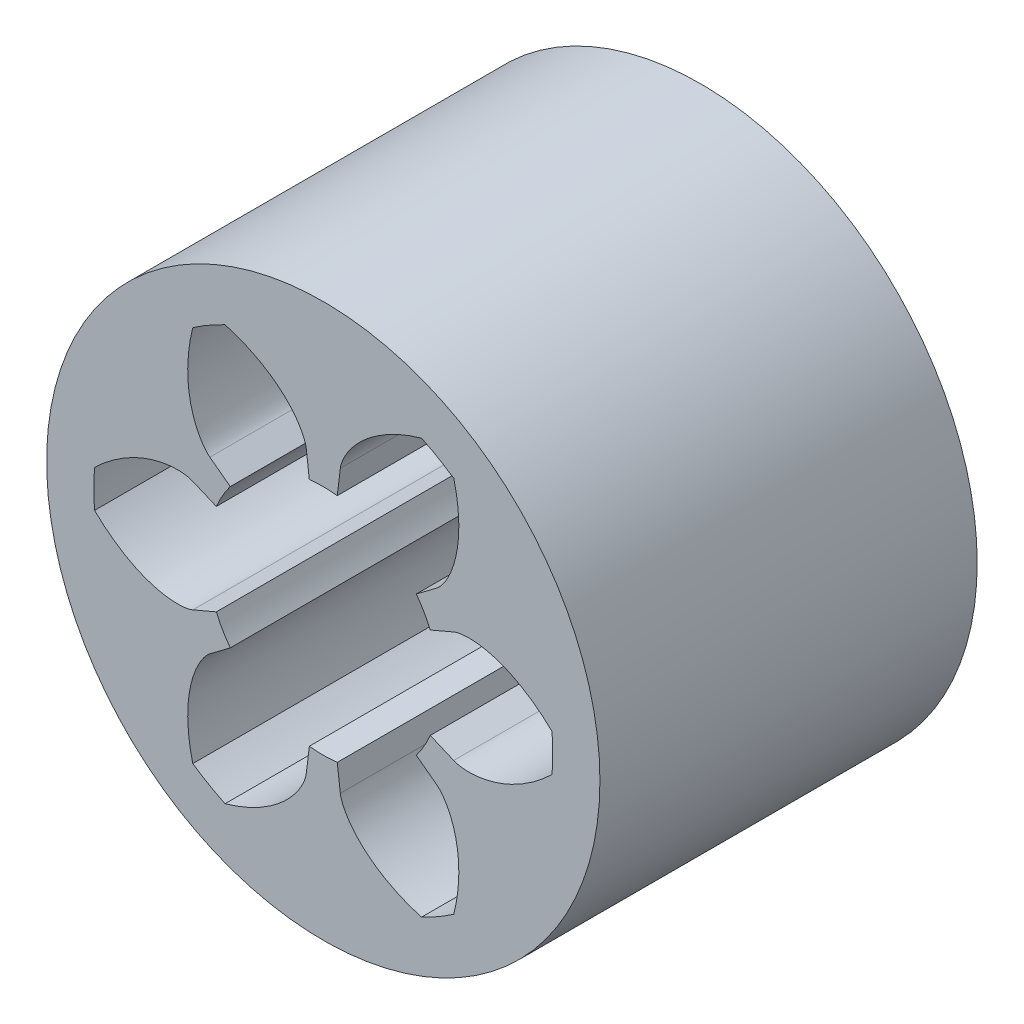
from build123d import *

# Parameters (mm, degrees)
SKETCH_1_R               = 2.2
SKETCH_1_R_2             = 0.925
EXTRUDE_1_DEPTH          = 3
CUT_EXTRUDE_2_DEPTH      = 5.322036557
PATTERN_CIRCULAR_1_COUNT = 6


with BuildPart() as part:
    # 草图1 → 凸台-拉伸1 (new body)
    with BuildSketch(Plane.XY):
        Circle(SKETCH_1_R)
        Circle(SKETCH_1_R_2, mode=Mode.SUBTRACT)
    extrude(amount=EXTRUDE_1_DEPTH)

    # 草图1<3> → 切除-拉伸2 (cut, through all)
    with BuildSketch(Plane.XY):
        with BuildLine():
            Line((1.03720071, 0.442455292), (0.85081958, 0.362947713))
            ThreePointArc((0.85081958, 0.362947713), (0.906265169, 0.185225388), (0.925, 0))
            ThreePointArc((0.925, 0), (0.906265169, -0.185225388), (0.85081958, -0.362947713))
            Line((0.85081958, -0.362947713), (1.03720071, -0.442455292))
            add(Edge.make_bspline(
                [(1.03720071, -0.442455292), (1.04510701, -0.445828009), (1.067871965, -0.453596987), (1.113314547, -0.461522157), (1.188023144, -0.464138789), (1.284367459, -0.452433849), (1.404657298, -0.420054467), (1.538436606, -0.361310704), (1.660601931, -0.285147073), (1.748638649, -0.214154324), (1.79986288, -0.166729965), (1.818980117, -0.1481092)],
                knots=[0, 0, 0, 0, 0, 0.005604068, 0.015718248, 0.029959916, 0.048733667, 0.068727063, 0.096888892, 0.125050566, 0.14248965, 0.14248965, 0.14248965, 0.14248965, 0.14248965], degree=4))
            ThreePointArc((1.818980117, -0.1481092), (1.823494408, -0.074115744), (1.825, 0))
            ThreePointArc((1.825, 0), (1.823494408, 0.074115744), (1.818980117, 0.1481092))
            add(Edge.make_bspline(
                [(1.03720071, 0.442455292), (1.04510701, 0.445828009), (1.067871965, 0.453596987), (1.113314547, 0.461522157), (1.188023144, 0.464138789), (1.284367459, 0.452433849), (1.404657298, 0.420054467), (1.538436606, 0.361310704), (1.660601931, 0.285147073), (1.748638649, 0.214154324), (1.79986288, 0.166729965), (1.818980117, 0.1481092)],
                knots=[0, 0, 0, 0, 0, 0.005604068, 0.015718248, 0.029959916, 0.048733667, 0.068727063, 0.096888892, 0.125050566, 0.14248965, 0.14248965, 0.14248965, 0.14248965, 0.14248965], degree=4))
        make_face()
    cut_extrude_2 = extrude(amount=CUT_EXTRUDE_2_DEPTH, mode=Mode.SUBTRACT)

    # 阵列(圆周)1: 切除-拉伸2 ×6 about axis
    pattern_circular_1_axis = Axis((0, 0, 3), (0, 0, 1))
    for i in range(1, PATTERN_CIRCULAR_1_COUNT):
        add(cut_extrude_2.rotate(pattern_circular_1_axis, i * 360 / PATTERN_CIRCULAR_1_COUNT), mode=Mode.SUBTRACT)


solid = part.part
